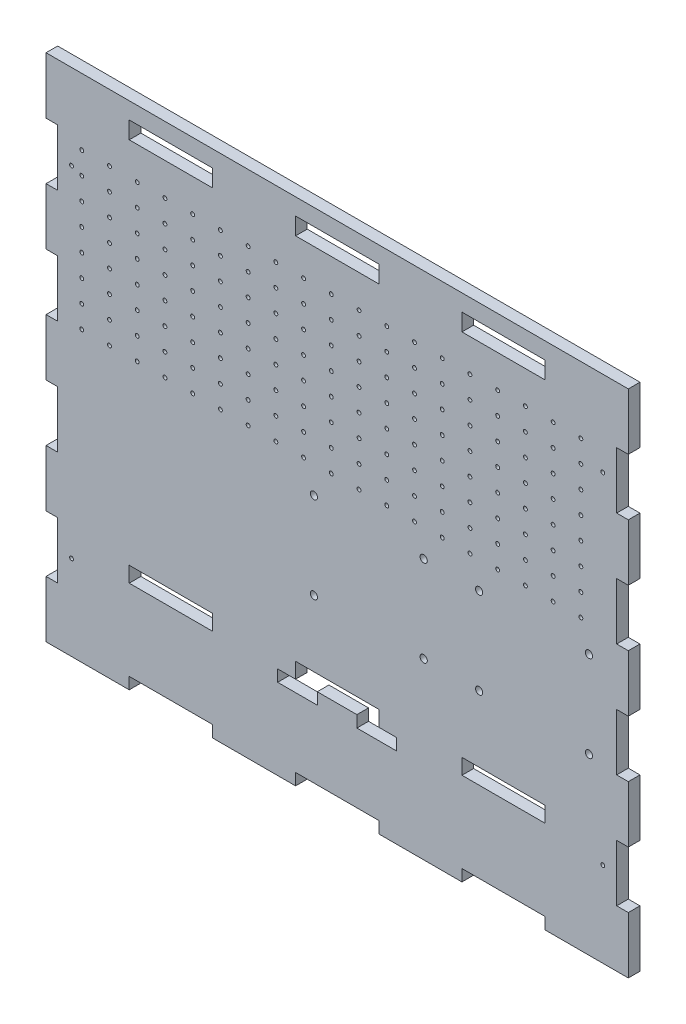
from build123d import *

# Parameters (mm, degrees)
SKETCH1_W                = 266.7
SKETCH1_H                = 223.52
BOSS_EXTRUDE1_DEPTH      = 5.334
SKETCH2_W                = 38.1
SKETCH2_H                = 5.334
CUT_EXTRUDE1_DEPTH       = 197.710659379
SKETCH5_W                = 38.1
SKETCH5_H                = 7.112
CUT_EXTRUDE3_DEPTH       = 197.710659379
SKETCH8_W                = 18.149934459
SKETCH8_H                = 5.334
SKETCH8_W_2              = 18.14993446
CUT_EXTRUDE6_DEPTH       = 197.710659379
SKETCH9_R                = 0.889
CUT_EXTRUDE7_DEPTH       = 197.710659379
SKETCH10_W               = 38.1
SKETCH10_H               = 5.334
BOSS_EXTRUDE2_DEPTH      = 10.16
BOSS_EXTRUDE3_DEPTH      = 76.2
BOSS_EXTRUDE3_DEPTH_BACK = 190.5
SKETCH12_W               = 5.334
SKETCH12_H               = 7.62
SKETCH13_W               = 38.1
SKETCH13_H               = 5.334
BOSS_EXTRUDE4_DEPTH      = 2.54
SKETCH14_W               = 38.1
SKETCH14_H               = 5.334
BOSS_EXTRUDE5_DEPTH      = 2.54
SKETCH15_W               = 38.1
SKETCH15_H               = 5.334
BOSS_EXTRUDE6_DEPTH      = 2.54
SKETCH16_W               = 5.334
SKETCH16_H               = 25.964444445
SKETCH16_H_2             = 25.964444444
CUT_EXTRUDE9_DEPTH       = 205.029793122
SKETCH17_R               = 1.651
CUT_EXTRUDE10_DEPTH      = 205.029793122
SKETCH18_R               = 0.889
CUT_EXTRUDE11_DEPTH      = 205.029793122


with BuildPart() as part:
    # Sketch1 → Boss-Extrude1 (new body)
    with BuildSketch(Plane.XY):
        with Locations((5.474099752, 27.504142138)):
            Rectangle(SKETCH1_W, SKETCH1_H)
    extrude(amount=BOSS_EXTRUDE1_DEPTH)

    # Sketch2 → Cut-Extrude1 (cut, through all)
    with BuildSketch(Plane.XY.offset(5.334)):
        with Locations((-70.725900248, -81.588857862)):
            Rectangle(SKETCH2_W, SKETCH2_H)
        with Locations((5.474099752, -81.588857862)):
            Rectangle(SKETCH2_W, SKETCH2_H)
        with Locations((81.674099752, -81.588857862)):
            Rectangle(SKETCH2_W, SKETCH2_H)
        with Locations((81.674099752, 136.597142138)):
            Rectangle(SKETCH2_W, SKETCH2_H)
        with Locations((5.474099752, 136.597142138)):
            Rectangle(SKETCH2_W, SKETCH2_H)
        with Locations((-70.725900248, 136.597142138)):
            Rectangle(SKETCH2_W, SKETCH2_H)
    extrude(amount=-CUT_EXTRUDE1_DEPTH, mode=Mode.SUBTRACT)

    # Sketch5 → Cut-Extrude3 (cut, through all)
    with BuildSketch(Plane.XY.offset(5.334)):
        with Locations((-70.725900248, -38.378413173)):
            Rectangle(SKETCH5_W, SKETCH5_H)
        with Locations((5.474099752, -38.378413173)):
            Rectangle(SKETCH5_W, SKETCH5_H)
        with Locations((81.674099752, -38.378413173)):
            Rectangle(SKETCH5_W, SKETCH5_H)
    extrude(amount=-CUT_EXTRUDE3_DEPTH, mode=Mode.SUBTRACT)

    # Sketch8 → Cut-Extrude6 (cut, through all)
    with BuildSketch(Plane.XY.offset(5.334)):
        with Locations((-12.722736397, -44.601413173)):
            Rectangle(SKETCH8_W, SKETCH8_H)
        with Locations((23.577132522, -44.601413173)):
            Rectangle(SKETCH8_W_2, SKETCH8_H)
    extrude(amount=-CUT_EXTRUDE6_DEPTH, mode=Mode.SUBTRACT)

    # Sketch9 → Cut-Extrude7 (cut, through all)
    with BuildSketch(Plane.XY.offset(5.334)):
        with Locations((-111.514346632, 118.978930244)):
            Circle(SKETCH9_R)
        with Locations((-98.814346632, 118.978930244)):
            Circle(SKETCH9_R)
        with Locations((-86.114346632, 118.978930244)):
            Circle(SKETCH9_R)
        with Locations((-73.414346632, 118.978930244)):
            Circle(SKETCH9_R)
        with Locations((-60.714346632, 118.978930244)):
            Circle(SKETCH9_R)
        with Locations((-48.014346632, 118.978930244)):
            Circle(SKETCH9_R)
        with Locations((-35.314346632, 118.978930244)):
            Circle(SKETCH9_R)
        with Locations((-22.614346632, 118.978930244)):
            Circle(SKETCH9_R)
        with Locations((-9.914346632, 118.978930244)):
            Circle(SKETCH9_R)
        with Locations((2.785653368, 118.978930244)):
            Circle(SKETCH9_R)
        with Locations((15.485653368, 118.978930244)):
            Circle(SKETCH9_R)
        with Locations((28.185653368, 118.978930244)):
            Circle(SKETCH9_R)
        with Locations((40.885653368, 118.978930244)):
            Circle(SKETCH9_R)
        with Locations((53.585653368, 118.978930244)):
            Circle(SKETCH9_R)
        with Locations((66.285653368, 118.978930244)):
            Circle(SKETCH9_R)
        with Locations((78.985653368, 118.978930244)):
            Circle(SKETCH9_R)
        with Locations((91.685653368, 118.978930244)):
            Circle(SKETCH9_R)
        with Locations((104.385653368, 118.978930244)):
            Circle(SKETCH9_R)
        with Locations((117.085653368, 118.978930244)):
            Circle(SKETCH9_R)
        with Locations((-111.514346632, 108.818930244)):
            Circle(SKETCH9_R)
        with Locations((-98.814346632, 108.818930244)):
            Circle(SKETCH9_R)
        with Locations((-86.114346632, 108.818930244)):
            Circle(SKETCH9_R)
        with Locations((-73.414346632, 108.818930244)):
            Circle(SKETCH9_R)
        with Locations((-60.714346632, 108.818930244)):
            Circle(SKETCH9_R)
        with Locations((-48.014346632, 108.818930244)):
            Circle(SKETCH9_R)
        with Locations((-35.314346632, 108.818930244)):
            Circle(SKETCH9_R)
        with Locations((-22.614346632, 108.818930244)):
            Circle(SKETCH9_R)
        with Locations((-9.914346632, 108.818930244)):
            Circle(SKETCH9_R)
        with Locations((2.785653368, 108.818930244)):
            Circle(SKETCH9_R)
        with Locations((15.485653368, 108.818930244)):
            Circle(SKETCH9_R)
        with Locations((28.185653368, 108.818930244)):
            Circle(SKETCH9_R)
        with Locations((40.885653368, 108.818930244)):
            Circle(SKETCH9_R)
        with Locations((53.585653368, 108.818930244)):
            Circle(SKETCH9_R)
        with Locations((66.285653368, 108.818930244)):
            Circle(SKETCH9_R)
        with Locations((78.985653368, 108.818930244)):
            Circle(SKETCH9_R)
        with Locations((91.685653368, 108.818930244)):
            Circle(SKETCH9_R)
        with Locations((104.385653368, 108.818930244)):
            Circle(SKETCH9_R)
        with Locations((117.085653368, 108.818930244)):
            Circle(SKETCH9_R)
        with Locations((-111.514346632, 98.658930244)):
            Circle(SKETCH9_R)
        with Locations((-98.814346632, 98.658930244)):
            Circle(SKETCH9_R)
        with Locations((-86.114346632, 98.658930244)):
            Circle(SKETCH9_R)
        with Locations((-73.414346632, 98.658930244)):
            Circle(SKETCH9_R)
        with Locations((-60.714346632, 98.658930244)):
            Circle(SKETCH9_R)
        with Locations((-48.014346632, 98.658930244)):
            Circle(SKETCH9_R)
        with Locations((-35.314346632, 98.658930244)):
            Circle(SKETCH9_R)
        with Locations((-22.614346632, 98.658930244)):
            Circle(SKETCH9_R)
        with Locations((-9.914346632, 98.658930244)):
            Circle(SKETCH9_R)
        with Locations((2.785653368, 98.658930244)):
            Circle(SKETCH9_R)
        with Locations((15.485653368, 98.658930244)):
            Circle(SKETCH9_R)
        with Locations((28.185653368, 98.658930244)):
            Circle(SKETCH9_R)
        with Locations((40.885653368, 98.658930244)):
            Circle(SKETCH9_R)
        with Locations((53.585653368, 98.658930244)):
            Circle(SKETCH9_R)
        with Locations((66.285653368, 98.658930244)):
            Circle(SKETCH9_R)
        with Locations((78.985653368, 98.658930244)):
            Circle(SKETCH9_R)
        with Locations((91.685653368, 98.658930244)):
            Circle(SKETCH9_R)
        with Locations((104.385653368, 98.658930244)):
            Circle(SKETCH9_R)
        with Locations((117.085653368, 98.658930244)):
            Circle(SKETCH9_R)
        with Locations((-111.514346632, 88.498930244)):
            Circle(SKETCH9_R)
        with Locations((-98.814346632, 88.498930244)):
            Circle(SKETCH9_R)
        with Locations((-86.114346632, 88.498930244)):
            Circle(SKETCH9_R)
        with Locations((-73.414346632, 88.498930244)):
            Circle(SKETCH9_R)
        with Locations((-60.714346632, 88.498930244)):
            Circle(SKETCH9_R)
        with Locations((-48.014346632, 88.498930244)):
            Circle(SKETCH9_R)
        with Locations((-35.314346632, 88.498930244)):
            Circle(SKETCH9_R)
        with Locations((-22.614346632, 88.498930244)):
            Circle(SKETCH9_R)
        with Locations((-9.914346632, 88.498930244)):
            Circle(SKETCH9_R)
        with Locations((2.785653368, 88.498930244)):
            Circle(SKETCH9_R)
        with Locations((15.485653368, 88.498930244)):
            Circle(SKETCH9_R)
        with Locations((28.185653368, 88.498930244)):
            Circle(SKETCH9_R)
        with Locations((40.885653368, 88.498930244)):
            Circle(SKETCH9_R)
        with Locations((53.585653368, 88.498930244)):
            Circle(SKETCH9_R)
        with Locations((66.285653368, 88.498930244)):
            Circle(SKETCH9_R)
        with Locations((78.985653368, 88.498930244)):
            Circle(SKETCH9_R)
        with Locations((91.685653368, 88.498930244)):
            Circle(SKETCH9_R)
        with Locations((104.385653368, 88.498930244)):
            Circle(SKETCH9_R)
        with Locations((117.085653368, 88.498930244)):
            Circle(SKETCH9_R)
        with Locations((-111.514346632, 78.338930244)):
            Circle(SKETCH9_R)
        with Locations((-98.814346632, 78.338930244)):
            Circle(SKETCH9_R)
        with Locations((-86.114346632, 78.338930244)):
            Circle(SKETCH9_R)
        with Locations((-73.414346632, 78.338930244)):
            Circle(SKETCH9_R)
        with Locations((-60.714346632, 78.338930244)):
            Circle(SKETCH9_R)
        with Locations((-48.014346632, 78.338930244)):
            Circle(SKETCH9_R)
        with Locations((-35.314346632, 78.338930244)):
            Circle(SKETCH9_R)
        with Locations((-22.614346632, 78.338930244)):
            Circle(SKETCH9_R)
        with Locations((-9.914346632, 78.338930244)):
            Circle(SKETCH9_R)
        with Locations((2.785653368, 78.338930244)):
            Circle(SKETCH9_R)
        with Locations((15.485653368, 78.338930244)):
            Circle(SKETCH9_R)
        with Locations((28.185653368, 78.338930244)):
            Circle(SKETCH9_R)
        with Locations((40.885653368, 78.338930244)):
            Circle(SKETCH9_R)
        with Locations((53.585653368, 78.338930244)):
            Circle(SKETCH9_R)
        with Locations((66.285653368, 78.338930244)):
            Circle(SKETCH9_R)
        with Locations((78.985653368, 78.338930244)):
            Circle(SKETCH9_R)
        with Locations((91.685653368, 78.338930244)):
            Circle(SKETCH9_R)
        with Locations((104.385653368, 78.338930244)):
            Circle(SKETCH9_R)
        with Locations((117.085653368, 78.338930244)):
            Circle(SKETCH9_R)
        with Locations((-111.514346632, 68.178930244)):
            Circle(SKETCH9_R)
        with Locations((-98.814346632, 68.178930244)):
            Circle(SKETCH9_R)
        with Locations((-86.114346632, 68.178930244)):
            Circle(SKETCH9_R)
        with Locations((-73.414346632, 68.178930244)):
            Circle(SKETCH9_R)
        with Locations((-60.714346632, 68.178930244)):
            Circle(SKETCH9_R)
        with Locations((-48.014346632, 68.178930244)):
            Circle(SKETCH9_R)
        with Locations((-35.314346632, 68.178930244)):
            Circle(SKETCH9_R)
        with Locations((-22.614346632, 68.178930244)):
            Circle(SKETCH9_R)
        with Locations((-9.914346632, 68.178930244)):
            Circle(SKETCH9_R)
        with Locations((2.785653368, 68.178930244)):
            Circle(SKETCH9_R)
        with Locations((15.485653368, 68.178930244)):
            Circle(SKETCH9_R)
        with Locations((28.185653368, 68.178930244)):
            Circle(SKETCH9_R)
        with Locations((40.885653368, 68.178930244)):
            Circle(SKETCH9_R)
        with Locations((53.585653368, 68.178930244)):
            Circle(SKETCH9_R)
        with Locations((66.285653368, 68.178930244)):
            Circle(SKETCH9_R)
        with Locations((78.985653368, 68.178930244)):
            Circle(SKETCH9_R)
        with Locations((91.685653368, 68.178930244)):
            Circle(SKETCH9_R)
        with Locations((104.385653368, 68.178930244)):
            Circle(SKETCH9_R)
        with Locations((117.085653368, 68.178930244)):
            Circle(SKETCH9_R)
        with Locations((-111.514346632, 58.018930244)):
            Circle(SKETCH9_R)
        with Locations((-98.814346632, 58.018930244)):
            Circle(SKETCH9_R)
        with Locations((-86.114346632, 58.018930244)):
            Circle(SKETCH9_R)
        with Locations((-73.414346632, 58.018930244)):
            Circle(SKETCH9_R)
        with Locations((-60.714346632, 58.018930244)):
            Circle(SKETCH9_R)
        with Locations((-48.014346632, 58.018930244)):
            Circle(SKETCH9_R)
        with Locations((-35.314346632, 58.018930244)):
            Circle(SKETCH9_R)
        with Locations((-22.614346632, 58.018930244)):
            Circle(SKETCH9_R)
        with Locations((-9.914346632, 58.018930244)):
            Circle(SKETCH9_R)
        with Locations((2.785653368, 58.018930244)):
            Circle(SKETCH9_R)
        with Locations((15.485653368, 58.018930244)):
            Circle(SKETCH9_R)
        with Locations((28.185653368, 58.018930244)):
            Circle(SKETCH9_R)
        with Locations((40.885653368, 58.018930244)):
            Circle(SKETCH9_R)
        with Locations((53.585653368, 58.018930244)):
            Circle(SKETCH9_R)
        with Locations((66.285653368, 58.018930244)):
            Circle(SKETCH9_R)
        with Locations((78.985653368, 58.018930244)):
            Circle(SKETCH9_R)
        with Locations((91.685653368, 58.018930244)):
            Circle(SKETCH9_R)
        with Locations((104.385653368, 58.018930244)):
            Circle(SKETCH9_R)
        with Locations((117.085653368, 58.018930244)):
            Circle(SKETCH9_R)
        with Locations((-111.514346632, 47.858930244)):
            Circle(SKETCH9_R)
        with Locations((-98.814346632, 47.858930244)):
            Circle(SKETCH9_R)
        with Locations((-86.114346632, 47.858930244)):
            Circle(SKETCH9_R)
        with Locations((-73.414346632, 47.858930244)):
            Circle(SKETCH9_R)
        with Locations((-60.714346632, 47.858930244)):
            Circle(SKETCH9_R)
        with Locations((-48.014346632, 47.858930244)):
            Circle(SKETCH9_R)
        with Locations((-35.314346632, 47.858930244)):
            Circle(SKETCH9_R)
        with Locations((-22.614346632, 47.858930244)):
            Circle(SKETCH9_R)
        with Locations((-9.914346632, 47.858930244)):
            Circle(SKETCH9_R)
        with Locations((2.785653368, 47.858930244)):
            Circle(SKETCH9_R)
        with Locations((15.485653368, 47.858930244)):
            Circle(SKETCH9_R)
        with Locations((28.185653368, 47.858930244)):
            Circle(SKETCH9_R)
        with Locations((40.885653368, 47.858930244)):
            Circle(SKETCH9_R)
        with Locations((53.585653368, 47.858930244)):
            Circle(SKETCH9_R)
        with Locations((66.285653368, 47.858930244)):
            Circle(SKETCH9_R)
        with Locations((78.985653368, 47.858930244)):
            Circle(SKETCH9_R)
        with Locations((91.685653368, 47.858930244)):
            Circle(SKETCH9_R)
        with Locations((104.385653368, 47.858930244)):
            Circle(SKETCH9_R)
        with Locations((117.085653368, 47.858930244)):
            Circle(SKETCH9_R)
    extrude(amount=-CUT_EXTRUDE7_DEPTH, mode=Mode.SUBTRACT)

    # Sketch10 → Boss-Extrude2 (add)
    with BuildSketch(Plane(origin=(0, 139.264142138, 0), x_dir=(1, 0, 0), z_dir=(0, 1, 0))):
        with Locations((-32.625900248, -2.667)):
            Rectangle(SKETCH10_W, SKETCH10_H)
    extrude(amount=BOSS_EXTRUDE2_DEPTH)

    # Sketch12 → Boss-Extrude3 (add, two sides: drawn at the far end of the back side and taken through both)
    with BuildSketch(Plane.ZY.offset(51.675900248).offset(-BOSS_EXTRUDE3_DEPTH_BACK)):
        with Locations((2.667, 145.614142138)):
            Rectangle(SKETCH12_W, SKETCH12_H)
    extrude(amount=BOSS_EXTRUDE3_DEPTH + BOSS_EXTRUDE3_DEPTH_BACK)

    # Sketch13 → Boss-Extrude4 (add)
    with BuildSketch(Plane(origin=(0, 139.264142138, 0), x_dir=(1, 0, 0), z_dir=(0, 1, 0))):
        with Locations((-108.825900248, -2.667)):
            Rectangle(SKETCH13_W, SKETCH13_H)
    extrude(amount=BOSS_EXTRUDE4_DEPTH)

    # Sketch14 → Boss-Extrude5 (add)
    with BuildSketch(Plane(origin=(0, 139.264142138, 0), x_dir=(1, 0, 0), z_dir=(0, 1, 0))):
        with Locations((43.574099752, -2.667)):
            Rectangle(SKETCH14_W, SKETCH14_H)
    extrude(amount=BOSS_EXTRUDE5_DEPTH)

    # Sketch15 → Boss-Extrude6 (add)
    with BuildSketch(Plane(origin=(0, 139.264142138, 0), x_dir=(1, 0, 0), z_dir=(0, 1, 0))):
        with Locations((119.774099752, -2.667)):
            Rectangle(SKETCH15_W, SKETCH15_H)
    extrude(amount=BOSS_EXTRUDE6_DEPTH)

    # Sketch16 → Cut-Extrude9 (cut, through all)
    with BuildSketch(Plane.XY.offset(5.334)):
        with Locations((-125.208900248, -45.309191196)):
            Rectangle(SKETCH16_W, SKETCH16_H)
        with Locations((-125.208900248, 6.619697693)):
            Rectangle(SKETCH16_W, SKETCH16_H)
        with Locations((-125.208900248, 58.548586582)):
            Rectangle(SKETCH16_W, SKETCH16_H_2)
        with Locations((-125.208900248, 110.477475471)):
            Rectangle(SKETCH16_W, SKETCH16_H_2)
        with Locations((136.157099752, 110.477475471)):
            Rectangle(SKETCH16_W, SKETCH16_H_2)
        with Locations((136.157099752, 58.548586582)):
            Rectangle(SKETCH16_W, SKETCH16_H_2)
        with Locations((136.157099752, 6.619697693)):
            Rectangle(SKETCH16_W, SKETCH16_H)
        with Locations((136.157099752, -45.309191196)):
            Rectangle(SKETCH16_W, SKETCH16_H)
    extrude(amount=-CUT_EXTRUDE9_DEPTH, mode=Mode.SUBTRACT)

    # Sketch17 → Cut-Extrude10 (cut, through all)
    with BuildSketch(Plane.XY.offset(5.334)):
        with Locations((120.790099752, 35.158930244)):
            Circle(SKETCH17_R)
        with Locations((70.498099752, 35.158930244)):
            Circle(SKETCH17_R)
        with Locations((70.498099752, -4.465069756)):
            Circle(SKETCH17_R)
        with Locations((120.790099752, -4.465069756)):
            Circle(SKETCH17_R)
        with Locations((45.098099752, 35.158930244)):
            Circle(SKETCH17_R)
        with Locations((-5.193900248, 35.158930244)):
            Circle(SKETCH17_R)
        with Locations((-5.193900248, -4.465069756)):
            Circle(SKETCH17_R)
        with Locations((45.098099752, -4.465069756)):
            Circle(SKETCH17_R)
    extrude(amount=-CUT_EXTRUDE10_DEPTH, mode=Mode.SUBTRACT)

    # Sketch18 → Cut-Extrude11 (cut, through all)
    with BuildSketch(Plane.XY.offset(5.334)):
        with Locations((127.140099752, 110.477475471)):
            Circle(SKETCH18_R)
        with Locations((-116.191900248, 110.477475471)):
            Circle(SKETCH18_R)
        with Locations((-116.191900248, -45.309191196)):
            Circle(SKETCH18_R)
        with Locations((127.140099752, -45.309191196)):
            Circle(SKETCH18_R)
    extrude(amount=-CUT_EXTRUDE11_DEPTH, mode=Mode.SUBTRACT)


solid = part.part
